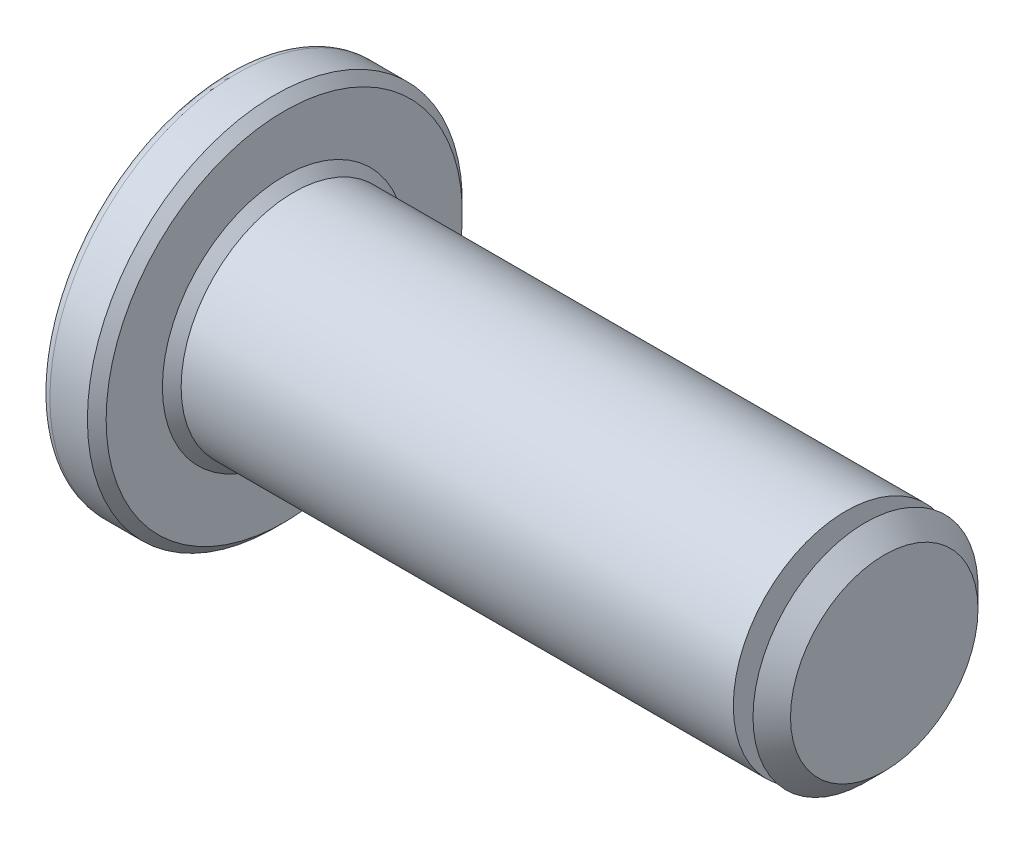
from build123d import *

# Parameters (mm, degrees)
SMUSSO1_SIZE = 0.5
SMUSSO2_SIZE = 0.5
SMUSSO3_SIZE = 1
RACCORDO1_R  = 0.5


with BuildPart() as part:
    # Schizzo1 → Rivoluzione1 (revolve)
    with BuildSketch(Plane.XY, mode=Mode.PRIVATE) as rivoluzione1_sk:
        Polygon((0, 0), (0, 10), (3, 10), (3, 6), (32.95, 6), (32.95, 4), (34, 4), (34, 6), (35, 6), (35, 0), align=None)
    revolve(rivoluzione1_sk.sketch.rotate(Axis((-16.326077986, 0, 0), (1, 0, 0)), 90), axis=Axis((-16.326077986, 0, 0), (1, 0, 0)))

    # Smusso1
    smusso1_edges = [part.edges().sort_by_distance(p)[0] for p in [
        (3, 0, -10),
    ]]
    chamfer(smusso1_edges, length=SMUSSO1_SIZE)

    # Smusso2
    smusso2_edges = [part.edges().sort_by_distance(p)[0] for p in [
        (3, 0, -6),
    ]]
    chamfer(smusso2_edges, length=SMUSSO2_SIZE)

    # Smusso3
    smusso3_edges = [part.edges().sort_by_distance(p)[0] for p in [
        (35, 0, -6),
    ]]
    chamfer(smusso3_edges, length=SMUSSO3_SIZE - 0.0001)  # a hair under: the kernel refuses the full size

    # Raccordo1
    raccordo1_edges = [part.edges().sort_by_distance(p)[0] for p in [
        (0, 0, -10),
    ]]
    fillet(raccordo1_edges, radius=RACCORDO1_R)


solid = part.part
